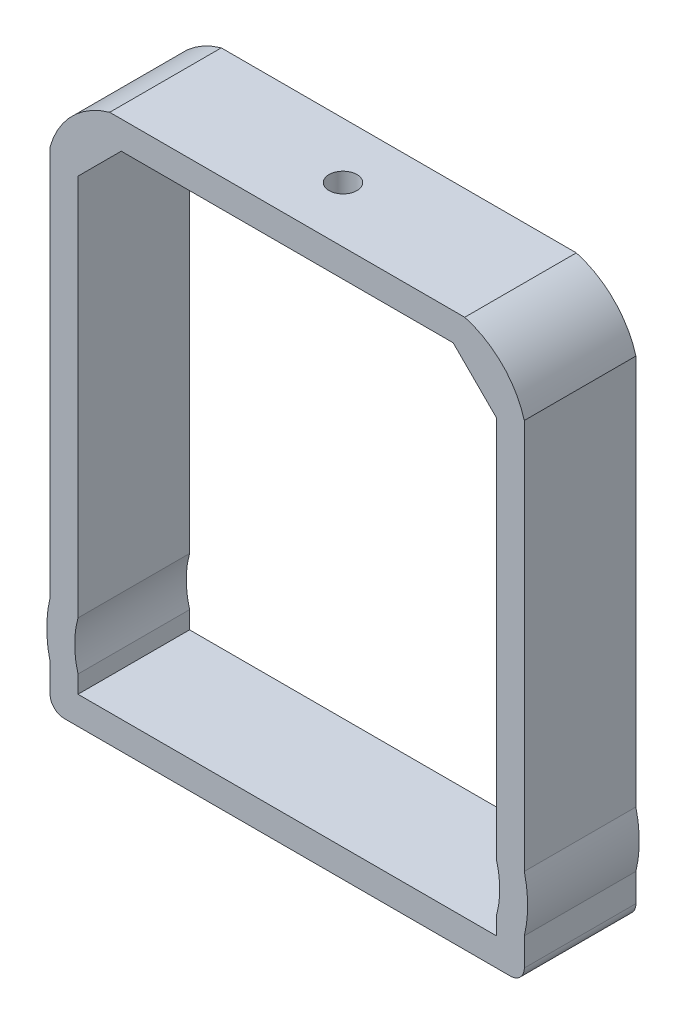
from build123d import *

# Parameters (mm, degrees)
BOSS_EXTRU_1_DEPTH      = 40
EPAISSIR2_DEPTH         = 40
EPAISSIR3_DEPTH         = 40
ESQUISSE11_R            = 5
ENL_V_MAT_EXTRU_1_DEPTH = 10
ECHELLE1_SCALE          = 0.25


# Read off the part's stored shape, not the designer's step: Epaissir2, Epaissir3
with BuildPart() as part:
    # Esquisse1 → Boss.-Extru.1 (new body)
    with BuildSketch(Plane.XY):
        with BuildLine():
            Line((-85, 105), (-63.639838362, 126.360161638))
            Line((-63.639838362, 126.360161638), (63.639838362, 126.360161638))
            Line((63.639838362, 126.360161638), (85, 105))
            Line((85, 105), (85, -35))
            ThreePointArc((85, -35), (86.201897264, -45), (85, -55))
            Line((85, -55), (85, -65))
            ThreePointArc((85, -65), (83.535533906, -68.535533906), (80, -70))
            Line((80, -70), (-80, -70))
            ThreePointArc((-80, -70), (-83.535533906, -68.535533906), (-85, -65))
            Line((-85, -65), (-85, -55))
            ThreePointArc((-85, -55), (-86.201897264, -45), (-85, -35))
            Line((-85, -35), (-85, 105))
        make_face()
        with BuildLine():
            Line((75, 100.857864376), (59.497702738, 116.360161638))
            Line((59.497702738, 116.360161638), (-59.497702738, 116.360161638))
            Line((-59.497702738, 116.360161638), (-75, 100.857864376))
            Line((-75, 100.857864376), (-75, -36.284378696))
            ThreePointArc((-75, -36.284378696), (-76.201897264, -45), (-75, -53.715621304))
            Line((-75, -53.715621304), (-75, -60))
            Line((-75, -60), (75, -60))
            Line((75, -60), (75, -53.715621304))
            ThreePointArc((75, -53.715621304), (76.201897264, -45), (75, -36.284378696))
            Line((75, -36.284378696), (75, 100.857864376))
        make_face(mode=Mode.SUBTRACT)
    extrude(amount=BOSS_EXTRU_1_DEPTH)

    # Epaissir2 outline → Epaissir2 (add)
    with BuildSketch(Plane.XY):
        with BuildLine():
            ThreePointArc((-63.639838362, 126.360161638), (-77.097387468, 118.457549106), (-85, 105))
            Line((-85, 105), (-63.639838362, 126.360161638))
        make_face()
    extrude(amount=EPAISSIR2_DEPTH)

    # Epaissir3 outline → Epaissir3 (add)
    with BuildSketch(Plane.XY):
        with BuildLine():
            ThreePointArc((85, 105), (77.097387468, 118.457549106), (63.639838362, 126.360161638))
            Line((63.639838362, 126.360161638), (85, 105))
        make_face()
    extrude(amount=EPAISSIR3_DEPTH)

    # Esquisse11 → Enlèv. mat.-Extru.1 (cut)
    with BuildSketch(Plane(origin=(0, 126.360161638, 0), x_dir=(1, 0, 0), z_dir=(0, 1, 0))):
        with Locations(Location((0, -20, 0), (0, 0, 270))):
            Circle(ESQUISSE11_R)
    extrude(amount=-ENL_V_MAT_EXTRU_1_DEPTH, mode=Mode.SUBTRACT)


with BuildPart() as part_1:
    # Echelle1: scaled about (0, 26.941606469, 20)
    add(part.part.scale(ECHELLE1_SCALE).moved(Location((0, 20.206204852, 15))))


solid = part_1.part
